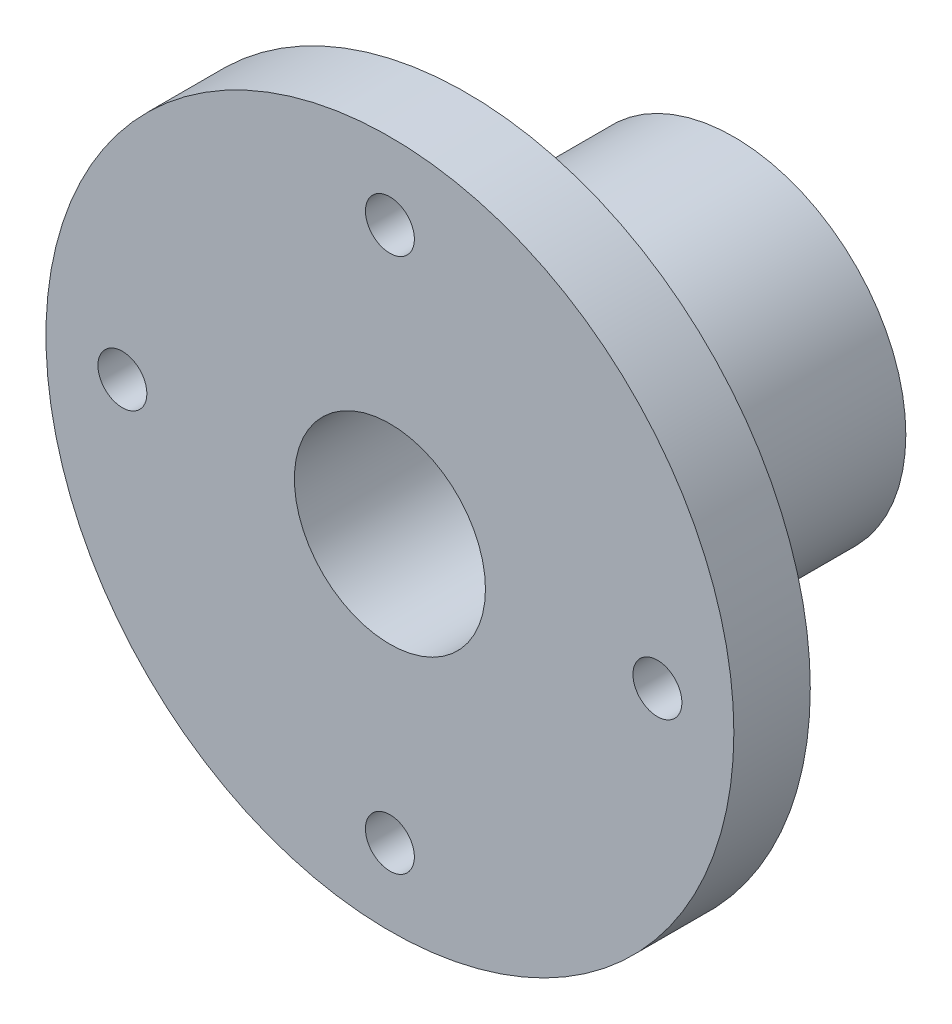
from build123d import *

# Parameters (mm, degrees)
SKETCH1_R                              = 22.5
SKETCH1_R_2                            = 12.5
BOSS_EXTRUDE1_DEPTH                    = 35
BOSS_EXTRUDE2_START                    = 10
SKETCH2_R                              = 45
SKETCH2_R_2                            = 12.5
BOSS_EXTRUDE2_DEPTH                    = 10
CUT_EXTRUDE1_START                     = 11
CUT_EXTRUDE1_DEPTH                     = 5.500000008
CUT_EXTRUDE1_START_2                   = -33
CUT_EXTRUDE1_2_DEPTH                   = 32
CBORE_FOR_M6_HEX_HEAD_BOLT1_AT_2_COUNT = 2
CBORE_FOR_M6_HEX_HEAD_BOLT1_AT_2_PITCH = 49.497474683
CBORE_FOR_M6_HEX_HEAD_BOLT1_AT_3_COUNT = 2
CBORE_FOR_M6_HEX_HEAD_BOLT1_AT_3_PITCH = 70
CBORE_FOR_M6_HEX_HEAD_BOLT1_AT_4_COUNT = 2
CBORE_FOR_M6_HEX_HEAD_BOLT1_AT_4_PITCH = 49.497474683


with BuildPart() as part:
    # Sketch1 → Boss-Extrude1 (new body)
    with BuildSketch(Plane.XY):
        Circle(SKETCH1_R)
        Circle(SKETCH1_R_2, mode=Mode.SUBTRACT)
    extrude(amount=-BOSS_EXTRUDE1_DEPTH)

    # Sketch2 → Boss-Extrude2 (add)
    with BuildSketch(Plane.XY.offset(BOSS_EXTRUDE2_START)):
        Circle(SKETCH2_R)
        Circle(SKETCH2_R_2, mode=Mode.SUBTRACT)
    extrude(amount=-BOSS_EXTRUDE2_DEPTH)

    # Cut-Extrude1: read off the stored shape, not the designer's step
    # Cut-Extrude1 outline → Cut-Extrude1 (cut)
    with BuildSketch(Plane(origin=(0, 0, 0), x_dir=(1, 0, 0), z_dir=(0, 1, 0)).offset(CUT_EXTRUDE1_START)):
        with BuildLine():
            add(Edge.make_bspline(
                [(-4, 28), (-4, 29.064380904), (-3.561099342, 30.095615587), (-2.096292766, 31.560700753), (-1.055346498, 31.998914356), (1.04710073, 32.001081394), (2.090364215, 31.566087585), (3.564946316, 30.092309962), (4, 29.064475319), (4, 28)],
                knots=[0, 0, 0, 0, 0.25, 0.25, 0.5, 0.5, 0.75, 0.75, 1, 1, 1, 1], degree=3))
            Line((-4, 28), (-4, 6))
            add(Edge.make_bspline(
                [(4, 6), (4, 4.935619096), (3.561099342, 3.904384413), (2.096292766, 2.439299247), (1.055346498, 2.001085644), (-1.04710073, 1.998918606), (-2.090364215, 2.433912415), (-3.564946316, 3.907690038), (-4, 4.935524681), (-4, 6)],
                knots=[0, 0, 0, 0, 0.25, 0.25, 0.5, 0.5, 0.75, 0.75, 1, 1, 1, 1], degree=3))
            Line((4, 6), (4, 28))
        make_face()
    extrude(amount=CUT_EXTRUDE1_DEPTH, mode=Mode.SUBTRACT)

    # Cut-Extrude1 2 outline → Cut-Extrude1 2 (add)
    with BuildSketch(Plane.XY.offset(CUT_EXTRUDE1_START_2)):
        with BuildLine():
            ThreePointArc((-4, 15.842719282), (-2.026821151, 16.334585361), (2.53e-07, 16.5))
            Line((2.53e-07, 16.5), (-4, 16.500000008))
            Line((-4, 16.500000008), (-4, 15.842719282))
        make_face()
        with BuildLine():
            ThreePointArc((2.53e-07, 16.5), (2.026821401, 16.33458532), (4, 15.842719282))
            Line((4, 15.842719282), (4, 16.500000008))
            Line((4, 16.500000008), (2.53e-07, 16.5))
        make_face()
    extrude(amount=CUT_EXTRUDE1_2_DEPTH)

    # Sketch5 → CBORE for M6 Hex Head Bolt1 (revolve, cut)
    with BuildSketch(Plane.YZ.offset(35)):
        Polygon((0, 0), (0, 10), (3.2, 10), (3.2, 4.38), (7.275, 4.38), (7.275, 0.025), (7.3, 0), align=None)
    cbore_for_m6_hex_head_bolt1 = revolve(axis=Axis((35, 0, -6.35), (0, 0, 1)), mode=Mode.SUBTRACT)

    # CBORE for M6 Hex Head Bolt1 at 2: CBORE for M6 Hex Head Bolt1 ×2
    with Locations(*[Vector(-0.7071067811865512, 0.7071067811865438, 0) * (i * CBORE_FOR_M6_HEX_HEAD_BOLT1_AT_2_PITCH) for i in range(1, CBORE_FOR_M6_HEX_HEAD_BOLT1_AT_2_COUNT)]):
        add(cbore_for_m6_hex_head_bolt1, mode=Mode.SUBTRACT)

    # CBORE for M6 Hex Head Bolt1 at 3: CBORE for M6 Hex Head Bolt1 ×2
    with Locations(*[(-i * CBORE_FOR_M6_HEX_HEAD_BOLT1_AT_3_PITCH, 0, 0) for i in range(1, CBORE_FOR_M6_HEX_HEAD_BOLT1_AT_3_COUNT)]):
        add(cbore_for_m6_hex_head_bolt1, mode=Mode.SUBTRACT)

    # CBORE for M6 Hex Head Bolt1 at 4: CBORE for M6 Hex Head Bolt1 ×2
    with Locations(*[Vector(-0.7071067811865414, -0.7071067811865538, 0) * (i * CBORE_FOR_M6_HEX_HEAD_BOLT1_AT_4_PITCH) for i in range(1, CBORE_FOR_M6_HEX_HEAD_BOLT1_AT_4_COUNT)]):
        add(cbore_for_m6_hex_head_bolt1, mode=Mode.SUBTRACT)


solid = part.part
